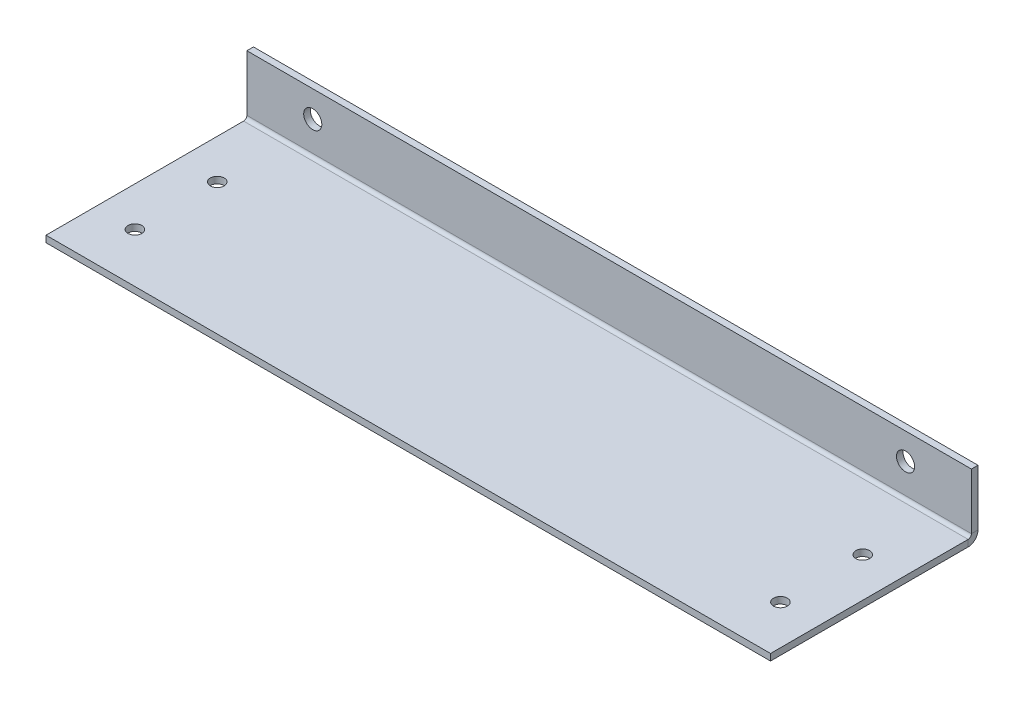
from build123d import *

# Parameters (mm, degrees)
SKETCH_1_W             = 220
SKETCH_1_H             = 60
SM_BASE_FLANGE_1_DEPTH = 2
SM_EDGE_FLANGE_1_DEPTH = 220
MM_1_D                 = 5.5
MM_1_DEPTH             = 8
MM_1_TIP               = 1.652366702
HOLE_WIZARD_M5_1_D     = 4.2
HOLE_WIZARD_M5_1_DEPTH = 12.4
HOLE_WIZARD_M5_1_TIP   = 1.2618073


# Sheet-metal steps are written as plain solids
with BuildPart() as part:
    # Sketch 1 → 基体-法兰1 (new body)
    with BuildSketch(Plane(origin=(0, 0, 0), x_dir=(1, 0, 0), z_dir=(0, 1, 0))):
        with Locations((0, 30)):
            Rectangle(SKETCH_1_W, SKETCH_1_H)
    extrude(amount=-SM_BASE_FLANGE_1_DEPTH)

    # 边线-法兰1 section (across the edge) → 边线-法兰1 (add)
    with BuildSketch(Plane(origin=(110, 0, -61), x_dir=(0, 0, 1), z_dir=(-1, 0, 0))):
        with BuildLine():
            Line((-2, 1), (-2, 18))
            Line((-2, 18), (0, 18))
            Line((0, 18), (0, 1))
            ThreePointArc((0, 1), (0.292893219, 0.292893219), (1, 0))
            Line((1, 0), (1, -2))
            ThreePointArc((1, -2), (-1.121320344, -1.121320344), (-2, 1))
        make_face()
    extrude(amount=SM_EDGE_FLANGE_1_DEPTH)

    # 大小mm 暗销孔1
    with Locations(Plane(origin=(90, 10, -61), x_dir=(0, 1, 0), z_dir=(0, 0, 1))):
        with Locations((0, 0), (0, 180)):
            Hole(MM_1_D / 2, depth=MM_1_DEPTH)
            with Locations((0, 0, -(MM_1_DEPTH + MM_1_TIP / 2))):  # 118° drill point
                Cone(0, MM_1_D / 2, MM_1_TIP, mode=Mode.SUBTRACT)

    # M5 螺纹孔1
    with Locations(Plane(origin=(98, 0, -40), x_dir=(0, 0, 1), z_dir=(0, 1, 0))):
        with Locations((0, 0), (25, 0), (0, -196), (25, -196)):
            Hole(HOLE_WIZARD_M5_1_D / 2, depth=HOLE_WIZARD_M5_1_DEPTH)
            with Locations((0, 0, -(HOLE_WIZARD_M5_1_DEPTH + HOLE_WIZARD_M5_1_TIP / 2))):  # 118° drill point
                Cone(0, HOLE_WIZARD_M5_1_D / 2, HOLE_WIZARD_M5_1_TIP, mode=Mode.SUBTRACT)


solid = part.part
